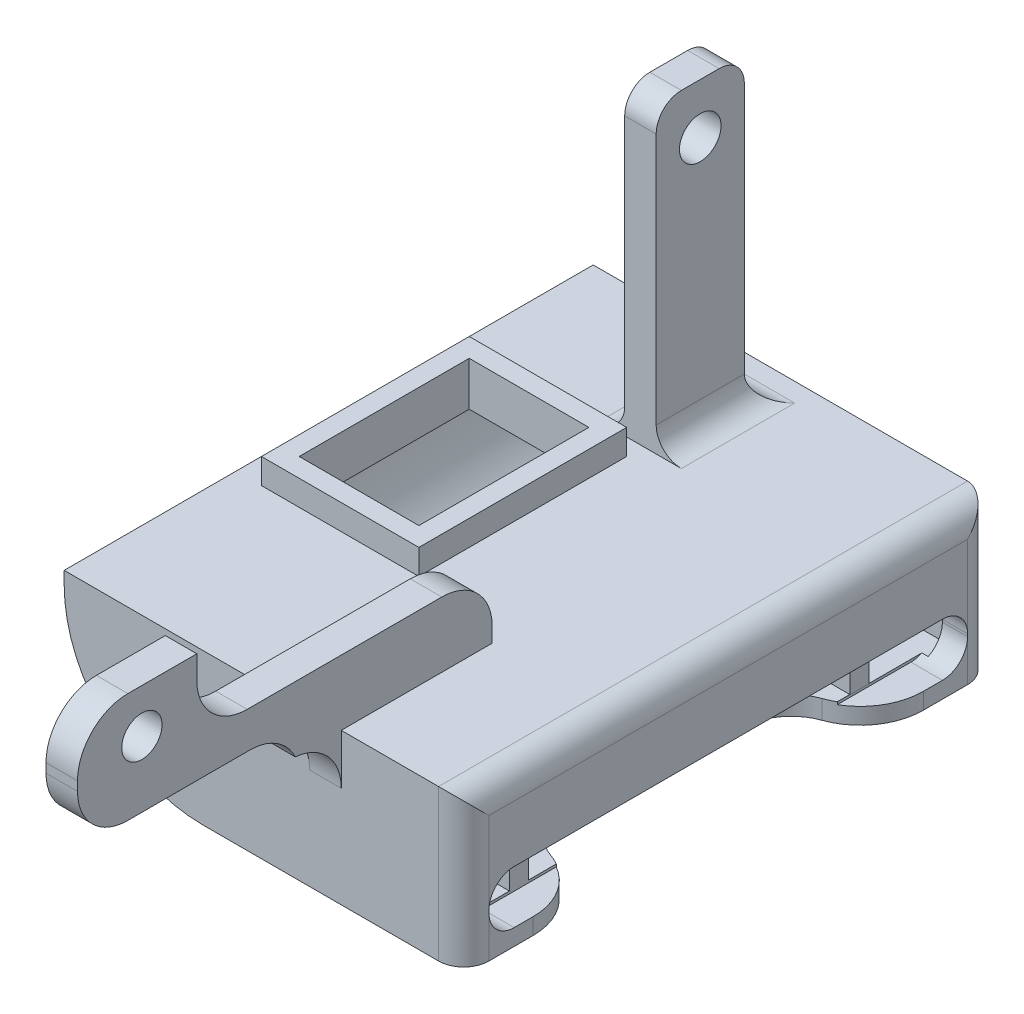
from build123d import *

# Parameters (mm, degrees)
SALIENTE_EXTRUIR1_DEPTH  = 12
CROQUIS2_W               = 12.5
CROQUIS2_H               = 16.5
CROQUIS2_W_2             = 9.5
CROQUIS2_H_2             = 13.5
SALIENTE_EXTRUIR2_DEPTH  = 2
SALIENTE_EXTRUIR4_DEPTH  = 11
CROQUIS4_R               = 1.6
CORTAR_EXTRUIR1_DEPTH    = 2.5
CROQUIS5_W               = 17.29289048
CROQUIS5_H               = 2.276098228
CROQUIS5_W_2             = 23.449996424
CROQUIS5_H_2             = 5.821617307
CORTAR_EXTRUIR2_DEPTH    = 2
SALIENTE_EXTRUIR5_DEPTH  = 3
CROQUIS7_W               = 60
CROQUIS7_H               = 12
SALIENTE_EXTRUIR6_DEPTH  = 3
CORTAR_EXTRUIR3_DEPTH    = 42
VACIADO4_START           = -15.778481013
VACIADO4_DEPTH           = 39
VACIADO4_2_OUTLINE_W     = 28
VACIADO4_2_OUTLINE_H     = 9
VACIADO4_2_DEPTH         = 4
VACIADO4_START_2         = 19.221518987
VACIADO4_3_OUTLINE_W     = 28
VACIADO4_3_OUTLINE_H     = 9
VACIADO4_3_DEPTH         = 4
VACIADO4_START_3         = -3.938481013
VACIADO4_4_OUTLINE_W     = 9.5
VACIADO4_4_OUTLINE_H     = 1.5
VACIADO4_4_DEPTH         = 13.5
REDONDEO2_R              = 4
REDONDEO3_R              = 4
CROQUIS10_W              = 2.5
CROQUIS10_H              = 7
SALIENTE_EXTRUIR8_DEPTH  = 24
CROQUIS11_R              = 1.65
CORTAR_EXTRUIR4_DEPTH    = 2.5
CROQUIS14_R              = 1.6
SALIENTE_EXTRUIR10_DEPTH = 0.5
CROQUIS15_W              = 28.276285021
CROQUIS15_H              = 42
CORTAR_EXTRUIR5_DEPTH    = 12
CROQUIS16_W              = 42
CROQUIS16_H              = 12
SALIENTE_EXTRUIR11_DEPTH = 2
CORTAR_EXTRUIR6_DEPTH    = 2.5
CROQUIS19_W              = 18.223714979
CROQUIS19_H              = 1.5
SALIENTE_EXTRUIR16_DEPTH = 9
REDONDEO4_R              = 2
REDONDEO5_R              = 2
REDONDEO6_R              = 2
CORTAR_EXTRUIR7_DEPTH    = 2
REDONDEO7_R              = 5
REDONDEO8_R              = 5


with BuildPart() as part:
    # Croquis1 → Saliente-Extruir1 (new body)
    with BuildSketch(Plane(origin=(0, 0, 0), x_dir=(1, 0, 0), z_dir=(0, 1, 0))):
        Polygon((30.683544304, -17.721518987), (30.683544304, -21.721518987), (-29.316455696, -21.721518987), (-29.316455696, 14.278481013), (30.683544304, 14.278481013), (30.683544304, 10.278481013), (2.683544304, 10.278481013), (2.683544304, -17.721518987), align=None)
    extrude(amount=SALIENTE_EXTRUIR1_DEPTH)

    # Croquis2 → Saliente-Extruir2 (add)
    with BuildSketch(Plane(origin=(0, 12, 0), x_dir=(1, 0, 0), z_dir=(0, 1, 0))):
        with Locations((-21.066455696, -2.811518987)):
            Rectangle(CROQUIS2_W, CROQUIS2_H)
        with Locations((-21.066455696, -2.811518987)):
            Rectangle(CROQUIS2_W_2, CROQUIS2_H_2, mode=Mode.SUBTRACT)
    extrude(amount=SALIENTE_EXTRUIR2_DEPTH)

    # Croquis3 → Saliente-Extruir4 (add)
    with BuildSketch(Plane(origin=(0, 12, 0), x_dir=(1, 0, 0), z_dir=(0, 1, 0))):
        Polygon((-7.816455696, -12.741518987), (-7.816455696, -41.560532566), (-7.816455696, -45.664219129), (-9.816455696, -45.664219129), (-9.816455696, -41.560532566), (-9.816455696, -12.741518987), align=None)
    extrude(amount=SALIENTE_EXTRUIR4_DEPTH)

    # Croquis4 → Cortar-Extruir1 (cut)
    with BuildSketch(Plane.ZY.offset(9.816455696)):
        with Locations((40.551518987, 19.507537468)):
            Circle(CROQUIS4_R)
    extrude(amount=-CORTAR_EXTRUIR1_DEPTH, mode=Mode.SUBTRACT)

    # Croquis5 → Cortar-Extruir2 (cut)
    with BuildSketch(Plane.ZY.offset(9.816455696)):
        with Locations((37.017773889, 13.138049114)):
            Rectangle(CROQUIS5_W, CROQUIS5_H)
        with Locations((24.466517199, 20.089191347)):
            Rectangle(CROQUIS5_W_2, CROQUIS5_H_2)
    extrude(amount=-CORTAR_EXTRUIR2_DEPTH, mode=Mode.SUBTRACT)

    # Croquis6 → Saliente-Extruir5 (add)
    with BuildSketch(Plane.XY.offset(21.721518987)):
        Polygon((-29.316455696, 0), (30.683544304, 0), (30.683544304, 12), (-7.816455696, 12), (-9.816455696, 12), (-29.316455696, 12), align=None)
    extrude(amount=SALIENTE_EXTRUIR5_DEPTH)

    # Croquis7 → Saliente-Extruir6 (add)
    with BuildSketch(Plane(origin=(0, 0, -14.278481013), x_dir=(-1, 0, 0), z_dir=(0, 0, -1))):
        with Locations((-0.683544304, 6)):
            Rectangle(CROQUIS7_W, CROQUIS7_H)
    extrude(amount=SALIENTE_EXTRUIR6_DEPTH)

    # Croquis8 → Cortar-Extruir3 (cut)
    with BuildSketch(Plane.XY.offset(24.721518987)):
        with BuildLine():
            Line((-29.316455696, 0), (-18.316455696, 0))
            ThreePointArc((-18.316455696, 0), (-26.094630289, 3.221825407), (-29.316455696, 11))
            Line((-29.316455696, 11), (-29.316455696, 0))
        make_face()
    extrude(amount=-CORTAR_EXTRUIR3_DEPTH, mode=Mode.SUBTRACT)

    # Vaciado4: read off the stored shape, not the designer's step
    # Vaciado4 outline → Vaciado4 (cut)
    with BuildSketch(Plane.XY.offset(VACIADO4_START)):
        with BuildLine():
            Line((1.183544304, 10.5), (-27.803288677, 10.5))
            ThreePointArc((-27.803288677, 10.5), (-24.854804112, 4.107975624), (-18.316455696, 1.5))
            Line((-18.316455696, 1.5), (1.183544304, 1.5))
            Line((1.183544304, 1.5), (1.183544304, 10.5))
        make_face()
    extrude(amount=VACIADO4_DEPTH, mode=Mode.SUBTRACT)

    # Vaciado4 2 outline → Vaciado4 2 (cut)
    with BuildSketch(Plane.XY.offset(VACIADO4_START)):
        with Locations((15.183544304, 6)):
            Rectangle(VACIADO4_2_OUTLINE_W, VACIADO4_2_OUTLINE_H)
    extrude(amount=VACIADO4_2_DEPTH, mode=Mode.SUBTRACT)

    # Vaciado4 3 outline → Vaciado4 3 (cut)
    with BuildSketch(Plane.XY.offset(VACIADO4_START_2)):
        with Locations((15.183544304, 6)):
            Rectangle(VACIADO4_3_OUTLINE_W, VACIADO4_3_OUTLINE_H)
    extrude(amount=VACIADO4_3_DEPTH, mode=Mode.SUBTRACT)

    # Vaciado4 4 outline → Vaciado4 4 (cut)
    with BuildSketch(Plane.XY.offset(VACIADO4_START_3)):
        with Locations((-21.066455696, 11.25)):
            Rectangle(VACIADO4_4_OUTLINE_W, VACIADO4_4_OUTLINE_H)
    extrude(amount=VACIADO4_4_DEPTH, mode=Mode.SUBTRACT)

    # Redondeo2
    # the kernel refuses this fillet: 4 mm, written as the material it adds along each edge
    with BuildSketch(Plane(origin=(-9.816455696, 12, 24.721518987), x_dir=(0, -1, 0), z_dir=(1, 0, 0))) as redondeo2_piece_1:
        with BuildLine():
            CenterArc((3.984641355, -4), REDONDEO2_R, 90, 84.977462971)
            Line((0, -3.649809662), (0, 0))
            Line((0, 0), (3.984641355, 0))
        make_face()
    extrude(amount=2)
    with BuildSketch(Plane(origin=(-9.816455696, 14.276098228, 28.371328649), x_dir=(0, 0, 1), z_dir=(1, 0, 0))) as redondeo2_piece_2:
        with BuildLine():
            CenterArc((3.609454623, 4), REDONDEO2_R, 205.52948015, 64.47051985)
            Line((0, 2.276098228), (0, 0))
            Line((0, 0), (3.609454623, 0))
        make_face()
    extrude(amount=2)
    with BuildSketch(Plane(origin=(-9.816455696, 17.178382693, 36.191515411), x_dir=(0, 0, -1), z_dir=(1, 0, 0))) as redondeo2_piece_3:
        with BuildLine():
            CenterArc((REDONDEO2_R, REDONDEO2_R), REDONDEO2_R, 180, 90)
            Line((0, REDONDEO2_R), (0, 0))
            Line((0, 0), (REDONDEO2_R, 0))
        make_face()
    extrude(amount=2)
    # the kernel refuses this fillet: 4 mm, written as the material it takes off along each edge
    with BuildSketch(Plane(origin=(-19.816455696, 17.178382693, 12.741518987), x_dir=(0, 0, 1), z_dir=(1, 0, 0))) as redondeo2_2_piece_1:
        with BuildLine():
            CenterArc((REDONDEO2_R, REDONDEO2_R), REDONDEO2_R, 180, 90)
            Line((0, REDONDEO2_R), (0, 0))
            Line((0, 0), (REDONDEO2_R, 0))
        make_face()
    extrude(amount=22, mode=Mode.SUBTRACT)

    # Redondeo3
    redondeo3_edges = [part.edges().sort_by_distance(p)[0] for p in [
        (-8.816455696, 23, 45.664219129),
        (-8.816455696, 14.276098228, 45.664219129),
    ]]
    fillet(redondeo3_edges, radius=REDONDEO3_R)

    # Croquis10 → Saliente-Extruir8 (add)
    with BuildSketch(Plane(origin=(0, 12, 0), x_dir=(1, 0, 0), z_dir=(0, 1, 0))):
        with Locations((-15.066455696, 10.278481013)):
            Rectangle(CROQUIS10_W, CROQUIS10_H)
    extrude(amount=SALIENTE_EXTRUIR8_DEPTH)

    # Croquis11 → Cortar-Extruir4 (cut)
    with BuildSketch(Plane.ZY.offset(16.316455696)):
        with Locations((-10.278481013, 32.003262859)):
            Circle(CROQUIS11_R)
    extrude(amount=-CORTAR_EXTRUIR4_DEPTH, mode=Mode.SUBTRACT)

    # Croquis14 → Saliente-Extruir10 (add)
    with BuildSketch(Plane(origin=(-7.816455696, 0, 0), x_dir=(0, 0, -1), z_dir=(1, 0, 0))):
        with BuildLine():
            Line((-36.191515411, 23), (-41.664219129, 23))
            ThreePointArc((-41.664219129, 23), (-44.492646254, 21.828427125), (-45.664219129, 19))
            Line((-45.664219129, 19), (-45.664219129, 18.276098228))
            ThreePointArc((-45.664219129, 18.276098228), (-44.492646254, 15.447671103), (-41.664219129, 14.276098228))
            Line((-41.664219129, 14.276098228), (-31.980783273, 14.276098228))
            ThreePointArc((-31.980783273, 14.276098228), (-29.847195577, 13.659558519), (-28.371328649, 12))
            ThreePointArc((-28.371328649, 12), (-25.771878217, 10.717139414), (-24.721518987, 8.015358645))
            Line((-24.721518987, 8.015358645), (-24.721518987, 12))
            Line((-24.721518987, 12), (-12.741518987, 12))
            Line((-12.741518987, 12), (-12.741518987, 13.178382693))
            ThreePointArc((-12.741518987, 13.178382693), (-13.913091863, 16.006809817), (-16.741518987, 17.178382693))
            Line((-16.741518987, 17.178382693), (-32.191515411, 17.178382693))
            ThreePointArc((-32.191515411, 17.178382693), (-35.019942535, 18.349955568), (-36.191515411, 21.178382693))
            Line((-36.191515411, 21.178382693), (-36.191515411, 23))
        make_face()
        with Locations(Location((-40.551518987, 19.507537468, 0), (0, 0, 180))):
            Circle(CROQUIS14_R, mode=Mode.SUBTRACT)
    extrude(amount=SALIENTE_EXTRUIR10_DEPTH)

    # Croquis15 → Cortar-Extruir5 (cut)
    with BuildSketch(Plane(origin=(0, 12, 0), x_dir=(1, 0, 0), z_dir=(0, 1, 0))):
        with Locations((16.545401794, -3.721518987)):
            Rectangle(CROQUIS15_W, CROQUIS15_H)
    extrude(amount=-CORTAR_EXTRUIR5_DEPTH, mode=Mode.SUBTRACT)

    # Croquis16 → Saliente-Extruir11 (add)
    with BuildSketch(Plane(origin=(2.407259283, 0, 0), x_dir=(0, 0, -1), z_dir=(1, 0, 0))):
        with Locations((-3.721518987, 6)):
            Rectangle(CROQUIS16_W, CROQUIS16_H)
    extrude(amount=-SALIENTE_EXTRUIR11_DEPTH)

    # Croquis18 → Cortar-Extruir6 (cut)
    with BuildSketch(Plane(origin=(2.407259283, 0, 0), x_dir=(0, 0, -1), z_dir=(1, 0, 0))):
        with BuildLine():
            Line((-20.721518987, 5.5), (13.278481013, 5.5))
            ThreePointArc((13.278481013, 5.5), (14.692694575, 4.914213562), (15.278481013, 3.5))
            Line((15.278481013, 3.5), (15.278481013, 3.3))
            ThreePointArc((15.278481013, 3.3), (14.692694575, 1.885786438), (13.278481013, 1.3))
            Line((13.278481013, 1.3), (-20.721518987, 1.3))
            ThreePointArc((-20.721518987, 1.3), (-22.13573255, 1.885786438), (-22.721518987, 3.3))
            Line((-22.721518987, 3.3), (-22.721518987, 3.5))
            ThreePointArc((-22.721518987, 3.5), (-22.13573255, 4.914213562), (-20.721518987, 5.5))
        make_face()
    extrude(amount=-CORTAR_EXTRUIR6_DEPTH, mode=Mode.SUBTRACT)

    # Croquis19 → Saliente-Extruir16 (add)
    with BuildSketch(Plane(origin=(0, 1.5, 0), x_dir=(1, 0, 0), z_dir=(0, 1, 0))):
        with Locations((-9.204598207, -17.846071371)):
            Rectangle(CROQUIS19_W, CROQUIS19_H)
        with Locations((-9.224216979, -4.59531752)):
            Rectangle(CROQUIS19_W, CROQUIS19_H)
        with Locations((-9.175696895, 9.179239743)):
            Rectangle(CROQUIS19_W, CROQUIS19_H)
    extrude(amount=SALIENTE_EXTRUIR16_DEPTH)

    # Redondeo4
    # the kernel refuses this fillet: 2 mm, written as the material it takes off along each edge
    with BuildSketch(Plane(origin=(2.407259283, 12, -22.278481013), x_dir=(-1, 0, 0), z_dir=(0, 0, 1))) as redondeo4_piece_1:
        with BuildLine():
            CenterArc((REDONDEO4_R, REDONDEO4_R), REDONDEO4_R, 180, 90)
            Line((0, REDONDEO4_R), (0, 0))
            Line((0, 0), (REDONDEO4_R, 0))
        make_face()
    extrude(amount=52, mode=Mode.SUBTRACT)
    with BuildSketch(Plane(origin=(2.407259283, 17, 24.721518987), x_dir=(-1, 0, 0), z_dir=(0, -1, 0)), Plane(origin=(2.407259283, 17, -17.278481013), x_dir=(0, 0, 1), z_dir=(0, -1, 0))) as redondeo4_piece_2:
        with BuildLine():
            CenterArc((REDONDEO4_R, REDONDEO4_R), REDONDEO4_R, 180, 90)
            Line((0, REDONDEO4_R), (0, 0))
            Line((0, 0), (REDONDEO4_R, 0))
        make_face()
    extrude(amount=22, mode=Mode.SUBTRACT)

    # Redondeo5
    redondeo5_edges = [part.edges().sort_by_distance(p)[0] for p in [
        (-15.066455696, 36, -13.778481013),
        (-15.066455696, 36, -6.778481013),
    ]]
    fillet(redondeo5_edges, radius=REDONDEO5_R)

    # Redondeo6
    redondeo6_edges = [part.edges().sort_by_distance(p)[0] for p in [
        (-13.816455696, 12, -10.278481013),
        (-15.066455696, 12, -13.778481013),
        (-16.316455696, 12, -10.278481013),
    ]]
    fillet(redondeo6_edges, radius=REDONDEO6_R)

    # Croquis20 → Cortar-Extruir7 (cut)
    with BuildSketch(Plane.XZ):
        with BuildLine():
            Line((2.407259283, 14.721518987), (0.407259283, 14.721518987))
            ThreePointArc((0.407259283, 14.721518987), (-2.421167842, 13.549946112), (-3.592740717, 10.721518987))
            Line((-3.592740717, 10.721518987), (-3.592740717, -3.278481013))
            ThreePointArc((-3.592740717, -3.278481013), (-2.421167842, -6.106908137), (0.407259283, -7.278481013))
            Line((0.407259283, -7.278481013), (2.407259283, -7.278481013))
            Line((2.407259283, -7.278481013), (2.407259283, 14.721518987))
        make_face()
    extrude(amount=-CORTAR_EXTRUIR7_DEPTH, mode=Mode.SUBTRACT)

    # Redondeo7
    # the kernel refuses this fillet: 5 mm, written as the material it takes off along each edge
    with BuildSketch(Plane(origin=(2.407259283, -11.213203436, -7.278481013), x_dir=(-0.9976533062578327, 0, 0.06846809850445046), z_dir=(0, 1, 0))) as redondeo7_piece_1_section:
        with BuildLine():
            CenterArc((4.681167844, -4.817096285), REDONDEO7_R, 105.545216035, 70.528779366)
            Line((-0.307098687, -4.474755793), (-0.80592534, -4.440521743))
            Line((-0.80592534, -4.440521743), (-0.498826653, 0.034234049))
            Line((-0.498826653, 0.034234049), (0.034234049, 0.498826653))
            ThreePointArc((0.034234049, 0.498826653), (2.029540662, 0.361890456), (3.207174666, 0.481709629))
            Line((3.207174666, 0.481709629), (3.341174046, 0))
        make_face()
    redondeo7_piece_1 = extrude(amount=23.726406871, mode=Mode.PRIVATE)
    redondeo7_piece_1 = split(redondeo7_piece_1, bisect_by=Plane(origin=(2.407259283, 1.5, -7.278481013), z_dir=(0, -1, 0)), keep=Keep.TOP, mode=Mode.PRIVATE)
    add(redondeo7_piece_1, mode=Mode.SUBTRACT)
    with BuildSketch(Plane(origin=(2.407259283, -11.213203436, 14.721518987), x_dir=(0, 0, 1), z_dir=(0, 1, 0))) as redondeo7_piece_2_section:
        with BuildLine():
            CenterArc((4.485281374, -5), REDONDEO7_R, 90, 70.528779366)
            Line((-0.228763834, -3.333333333), (-0.700168354, -3.166666667))
            ThreePointArc((-0.700168354, -3.166666667), (-0.5, -2), (-0.5, 0))
            Line((-0.5, 0), (0, 0.5))
            Line((0, 0.5), (4.485281374, 0.5))
            Line((4.485281374, 0.5), (4.485281374, 0))
        make_face()
    redondeo7_piece_2 = extrude(amount=23.726406871, mode=Mode.PRIVATE)
    redondeo7_piece_2 = split(redondeo7_piece_2, bisect_by=Plane(origin=(2.407259283, 1.5, 14.721518987), z_dir=(0, -1, 0)), keep=Keep.TOP, mode=Mode.PRIVATE)
    add(redondeo7_piece_2, mode=Mode.SUBTRACT)

    # Redondeo8
    # the kernel refuses this fillet: 5 mm, written as the material it takes off along each edge
    with BuildSketch(Plane(origin=(-0.11235949, 2, -8.063386961), x_dir=(-1, 0, 0), z_dir=(0, 0, 1))) as redondeo8_piece_1_section:
        with BuildLine():
            CenterArc((5, -4.763481792), REDONDEO8_R, 107.693426123, 72.306573877)
            Line((0, -4.763481792), (0, 0))
            Line((0, 0), (3.480381227, 0))
        make_face()
    redondeo8_piece_1 = extrude(amount=25.317408961, mode=Mode.PRIVATE)
    redondeo8_piece_1 = split(redondeo8_piece_1, bisect_by=Plane(origin=(-0.11235949, 2, 17.096071371), z_dir=(0, 0, -1)), keep=Keep.TOP, mode=Mode.PRIVATE)
    add(redondeo8_piece_1, mode=Mode.SUBTRACT)


solid = part.part
